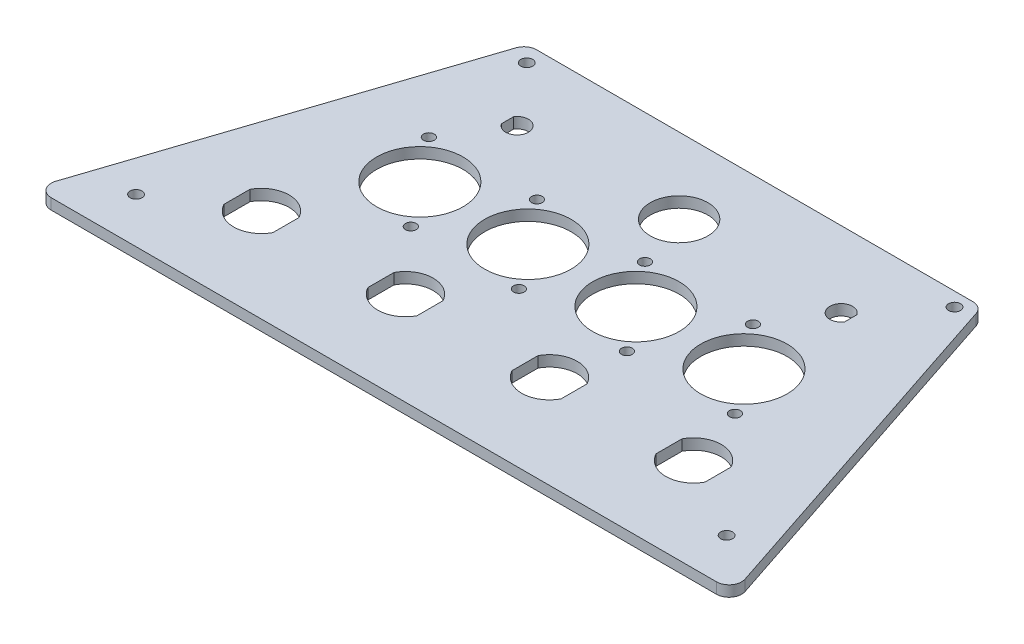
from build123d import *

# Parameters (mm, degrees)
BASE_FLANGE1_DEPTH  = 3
CUT_EXTRUDE3_REACH  = 143.098
SKETCH23_R          = 12
SKETCH23_R_2        = 1.5
CUT_EXTRUDE5_REACH  = 143.098
SKETCH25_R          = 8
SKETCH30_R          = 1.65
CUT_EXTRUDE7_DEPTH  = 3
CUT_EXTRUDE9_DEPTH  = 3
CUT_EXTRUDE10_DEPTH = 3


# Sheet-metal steps are written as plain solids
with BuildPart() as part:
    # Sketch1 → Base-Flange1 (new body)
    with BuildSketch(Plane(origin=(0, 0, 0), x_dir=(1, 0, 0), z_dir=(0, 1, 0))):
        with BuildLine():
            Line((-63.892333426, 101.078420902), (-95.697333426, 5.100954406))
            ThreePointArc((-95.697333426, 5.100954406), (-95.212546513, 1.951017377), (-92.375, 0.5))
            Line((-92.375, 0.5), (92.375, 0.5))
            ThreePointArc((92.375, 0.5), (95.212546513, 1.951017377), (95.697333426, 5.100954406))
            Line((95.697333426, 5.100954406), (63.892333426, 101.078420902))
            ThreePointArc((63.892333426, 101.078420902), (62.618982623, 102.815013009), (60.57, 103.477466496))
            Line((60.57, 103.477466496), (-60.57, 103.477466496))
            ThreePointArc((-60.57, 103.477466496), (-62.618982623, 102.815013009), (-63.892333426, 101.078420902))
        make_face()
    extrude(amount=-BASE_FLANGE1_DEPTH)

    # Sketch23 → Cut-Extrude3 (cut, up to next)
    with BuildSketch(Plane(origin=(0, 0, 0), x_dir=(1, 0, 0), z_dir=(0, 1, 0)), mode=Mode.PRIVATE) as cut_extrude3_sk1:
        with Locations(Location((-45, 55.5, 0), (0, 0, 270))):
            Circle(SKETCH23_R)
    cut_extrude3_tool1 = extrude(cut_extrude3_sk1.sketch, amount=-CUT_EXTRUDE3_REACH, mode=Mode.PRIVATE) & part.part
    # Sketch23 → Cut-Extrude3 (cut, up to next)
    with BuildSketch(Plane(origin=(0, 0, 0), x_dir=(1, 0, 0), z_dir=(0, 1, 0)), mode=Mode.PRIVATE) as cut_extrude3_sk2:
        with Locations(Location((-15, 55.5, 0), (0, 0, 270))):
            Circle(SKETCH23_R)
    cut_extrude3_tool2 = extrude(cut_extrude3_sk2.sketch, amount=-CUT_EXTRUDE3_REACH, mode=Mode.PRIVATE) & part.part
    # Sketch23 → Cut-Extrude3 (cut, up to next)
    with BuildSketch(Plane(origin=(0, 0, 0), x_dir=(1, 0, 0), z_dir=(0, 1, 0)), mode=Mode.PRIVATE) as cut_extrude3_sk3:
        with Locations(Location((15, 55.5, 0), (0, 0, 270))):
            Circle(SKETCH23_R)
    cut_extrude3_tool3 = extrude(cut_extrude3_sk3.sketch, amount=-CUT_EXTRUDE3_REACH, mode=Mode.PRIVATE) & part.part
    # Sketch23 → Cut-Extrude3 (cut, up to next)
    with BuildSketch(Plane(origin=(0, 0, 0), x_dir=(1, 0, 0), z_dir=(0, 1, 0)), mode=Mode.PRIVATE) as cut_extrude3_sk4:
        with Locations(Location((45, 55.5, 0), (0, 0, 270))):
            Circle(SKETCH23_R)
    cut_extrude3_tool4 = extrude(cut_extrude3_sk4.sketch, amount=-CUT_EXTRUDE3_REACH, mode=Mode.PRIVATE) & part.part
    # Sketch23 → Cut-Extrude3 (cut, up to next)
    with BuildSketch(Plane(origin=(0, 0, 0), x_dir=(1, 0, 0), z_dir=(0, 1, 0)), mode=Mode.PRIVATE) as cut_extrude3_sk5:
        with Locations(Location((-54.5, 67.5, 0), (0, 0, 270))):
            Circle(SKETCH23_R_2)
    cut_extrude3_tool5 = extrude(cut_extrude3_sk5.sketch, amount=-CUT_EXTRUDE3_REACH, mode=Mode.PRIVATE) & part.part
    # Sketch23 → Cut-Extrude3 (cut, up to next)
    with BuildSketch(Plane(origin=(0, 0, 0), x_dir=(1, 0, 0), z_dir=(0, 1, 0)), mode=Mode.PRIVATE) as cut_extrude3_sk6:
        with Locations(Location((-35.5, 43.5, 0), (0, 0, 270))):
            Circle(SKETCH23_R_2)
    cut_extrude3_tool6 = extrude(cut_extrude3_sk6.sketch, amount=-CUT_EXTRUDE3_REACH, mode=Mode.PRIVATE) & part.part
    # Sketch23 → Cut-Extrude3 (cut, up to next)
    with BuildSketch(Plane(origin=(0, 0, 0), x_dir=(1, 0, 0), z_dir=(0, 1, 0)), mode=Mode.PRIVATE) as cut_extrude3_sk7:
        with Locations(Location((-24.5, 67.5, 0), (0, 0, 270))):
            Circle(SKETCH23_R_2)
    cut_extrude3_tool7 = extrude(cut_extrude3_sk7.sketch, amount=-CUT_EXTRUDE3_REACH, mode=Mode.PRIVATE) & part.part
    # Sketch23 → Cut-Extrude3 (cut, up to next)
    with BuildSketch(Plane(origin=(0, 0, 0), x_dir=(1, 0, 0), z_dir=(0, 1, 0)), mode=Mode.PRIVATE) as cut_extrude3_sk8:
        with Locations(Location((-5.5, 43.5, 0), (0, 0, 270))):
            Circle(SKETCH23_R_2)
    cut_extrude3_tool8 = extrude(cut_extrude3_sk8.sketch, amount=-CUT_EXTRUDE3_REACH, mode=Mode.PRIVATE) & part.part
    # Sketch23 → Cut-Extrude3 (cut, up to next)
    with BuildSketch(Plane(origin=(0, 0, 0), x_dir=(1, 0, 0), z_dir=(0, 1, 0)), mode=Mode.PRIVATE) as cut_extrude3_sk9:
        with Locations(Location((5.5, 67.5, 0), (0, 0, 270))):
            Circle(SKETCH23_R_2)
    cut_extrude3_tool9 = extrude(cut_extrude3_sk9.sketch, amount=-CUT_EXTRUDE3_REACH, mode=Mode.PRIVATE) & part.part
    # Sketch23 → Cut-Extrude3 (cut, up to next)
    with BuildSketch(Plane(origin=(0, 0, 0), x_dir=(1, 0, 0), z_dir=(0, 1, 0)), mode=Mode.PRIVATE) as cut_extrude3_sk10:
        with Locations(Location((24.5, 43.5, 0), (0, 0, 270))):
            Circle(SKETCH23_R_2)
    cut_extrude3_tool10 = extrude(cut_extrude3_sk10.sketch, amount=-CUT_EXTRUDE3_REACH, mode=Mode.PRIVATE) & part.part
    # Sketch23 → Cut-Extrude3 (cut, up to next)
    with BuildSketch(Plane(origin=(0, 0, 0), x_dir=(1, 0, 0), z_dir=(0, 1, 0)), mode=Mode.PRIVATE) as cut_extrude3_sk11:
        with Locations(Location((35.5, 67.5, 0), (0, 0, 270))):
            Circle(SKETCH23_R_2)
    cut_extrude3_tool11 = extrude(cut_extrude3_sk11.sketch, amount=-CUT_EXTRUDE3_REACH, mode=Mode.PRIVATE) & part.part
    # Sketch23 → Cut-Extrude3 (cut, up to next)
    with BuildSketch(Plane(origin=(0, 0, 0), x_dir=(1, 0, 0), z_dir=(0, 1, 0)), mode=Mode.PRIVATE) as cut_extrude3_sk12:
        with Locations(Location((54.5, 43.5, 0), (0, 0, 270))):
            Circle(SKETCH23_R_2)
    cut_extrude3_tool12 = extrude(cut_extrude3_sk12.sketch, amount=-CUT_EXTRUDE3_REACH, mode=Mode.PRIVATE) & part.part
    add(cut_extrude3_tool1.solids().sort_by_distance((-45, 0, -55.5))[0], mode=Mode.SUBTRACT)
    add(cut_extrude3_tool2.solids().sort_by_distance((-15, 0, -55.5))[0], mode=Mode.SUBTRACT)
    add(cut_extrude3_tool3.solids().sort_by_distance((15, 0, -55.5))[0], mode=Mode.SUBTRACT)
    add(cut_extrude3_tool4.solids().sort_by_distance((45, 0, -55.5))[0], mode=Mode.SUBTRACT)
    add(cut_extrude3_tool5.solids().sort_by_distance((-54.5, 0, -67.5))[0], mode=Mode.SUBTRACT)
    add(cut_extrude3_tool6.solids().sort_by_distance((-35.5, 0, -43.5))[0], mode=Mode.SUBTRACT)
    add(cut_extrude3_tool7.solids().sort_by_distance((-24.5, 0, -67.5))[0], mode=Mode.SUBTRACT)
    add(cut_extrude3_tool8.solids().sort_by_distance((-5.5, 0, -43.5))[0], mode=Mode.SUBTRACT)
    add(cut_extrude3_tool9.solids().sort_by_distance((5.5, 0, -67.5))[0], mode=Mode.SUBTRACT)
    add(cut_extrude3_tool10.solids().sort_by_distance((24.5, 0, -43.5))[0], mode=Mode.SUBTRACT)
    add(cut_extrude3_tool11.solids().sort_by_distance((35.5, 0, -67.5))[0], mode=Mode.SUBTRACT)
    add(cut_extrude3_tool12.solids().sort_by_distance((54.5, 0, -43.5))[0], mode=Mode.SUBTRACT)

    # Sketch25 → Cut-Extrude5 (cut, up to next)
    with BuildSketch(Plane(origin=(0, 0, 0), x_dir=(1, 0, 0), z_dir=(0, 1, 0)), mode=Mode.PRIVATE) as cut_extrude5_sk1:
        with Locations(Location((0, 82.5, 0), (0, 0, 270))):
            Circle(SKETCH25_R)
    cut_extrude5_tool1 = extrude(cut_extrude5_sk1.sketch, amount=-CUT_EXTRUDE5_REACH, mode=Mode.PRIVATE) & part.part
    add(cut_extrude5_tool1.solids().sort_by_distance((0, 0, -82.5))[0], mode=Mode.SUBTRACT)

    # Sketch30 → Cut-Extrude7 (cut)
    with BuildSketch(Plane.XZ.offset(3)):
        with Locations(Location((-81.400291533, -13.08225267, 0), (0, 0, 270))):
            Circle(SKETCH30_R)
        with Locations(Location((82.599708467, -13.08225267, 0), (0, 0, 270))):
            Circle(SKETCH30_R)
        with Locations(Location((-58.793005262, -98.97646978, 0), (0, 0, 270))):
            Circle(SKETCH30_R)
        with Locations(Location((59.357506456, -99.619637978, 0), (0, 0, 270))):
            Circle(SKETCH30_R)
    extrude(amount=-CUT_EXTRUDE7_DEPTH, mode=Mode.SUBTRACT)

    # Sketch32 → Cut-Extrude9 (cut)
    with BuildSketch(Plane(origin=(0, 0, 0), x_dir=(1, 0, 0), z_dir=(0, 1, 0))):
        with BuildLine():
            Line((-66.8, 30.112478374), (-66.8, 22.887521626))
            ThreePointArc((-66.8, 22.887521626), (-60, 18.8), (-53.2, 22.887521626))
            Line((-53.2, 22.887521626), (-53.2, 30.112478374))
            ThreePointArc((-53.2, 30.112478374), (-60, 34.2), (-66.8, 30.112478374))
        make_face()
        with BuildLine():
            Line((-13.2, 30.112478374), (-13.2, 22.887521626))
            ThreePointArc((-13.2, 22.887521626), (-20, 18.8), (-26.8, 22.887521626))
            Line((-26.8, 22.887521626), (-26.8, 30.112478374))
            ThreePointArc((-26.8, 30.112478374), (-20, 34.2), (-13.2, 30.112478374))
        make_face()
        with BuildLine():
            Line((26.8, 30.112478374), (26.8, 22.887521626))
            ThreePointArc((26.8, 22.887521626), (20, 18.8), (13.2, 22.887521626))
            Line((13.2, 22.887521626), (13.2, 30.112478374))
            ThreePointArc((13.2, 30.112478374), (20, 34.2), (26.8, 30.112478374))
        make_face()
        with BuildLine():
            Line((66.8, 30.112478374), (66.8, 22.887521626))
            ThreePointArc((66.8, 22.887521626), (60, 18.8), (53.2, 22.887521626))
            Line((53.2, 22.887521626), (53.2, 30.112478374))
            ThreePointArc((53.2, 30.112478374), (60, 34.2), (66.8, 30.112478374))
        make_face()
    extrude(amount=-CUT_EXTRUDE9_DEPTH, mode=Mode.SUBTRACT)

    # Sketch33 → Cut-Extrude10 (cut)
    with BuildSketch(Plane(origin=(0, 0, 0), x_dir=(1, 0, 0), z_dir=(0, 1, 0))):
        with BuildLine():
            Line((47.65, 84.202938637), (47.65, 80.797061363))
            ThreePointArc((47.65, 80.797061363), (45, 79.35), (42.35, 80.797061363))
            ThreePointArc((42.35, 80.797061363), (41.85, 82.5), (42.35, 84.202938637))
            ThreePointArc((42.35, 84.202938637), (45, 85.65), (47.65, 84.202938637))
        make_face()
    cut_extrude10 = extrude(amount=-CUT_EXTRUDE10_DEPTH, mode=Mode.SUBTRACT)

    # Mirror1: Cut-Extrude10 across plane
    add(cut_extrude10.mirror(Plane(origin=(0, 0, 0), x_dir=(0, 0, 1), z_dir=(1, 0, 0))), mode=Mode.SUBTRACT)


solid = part.part
